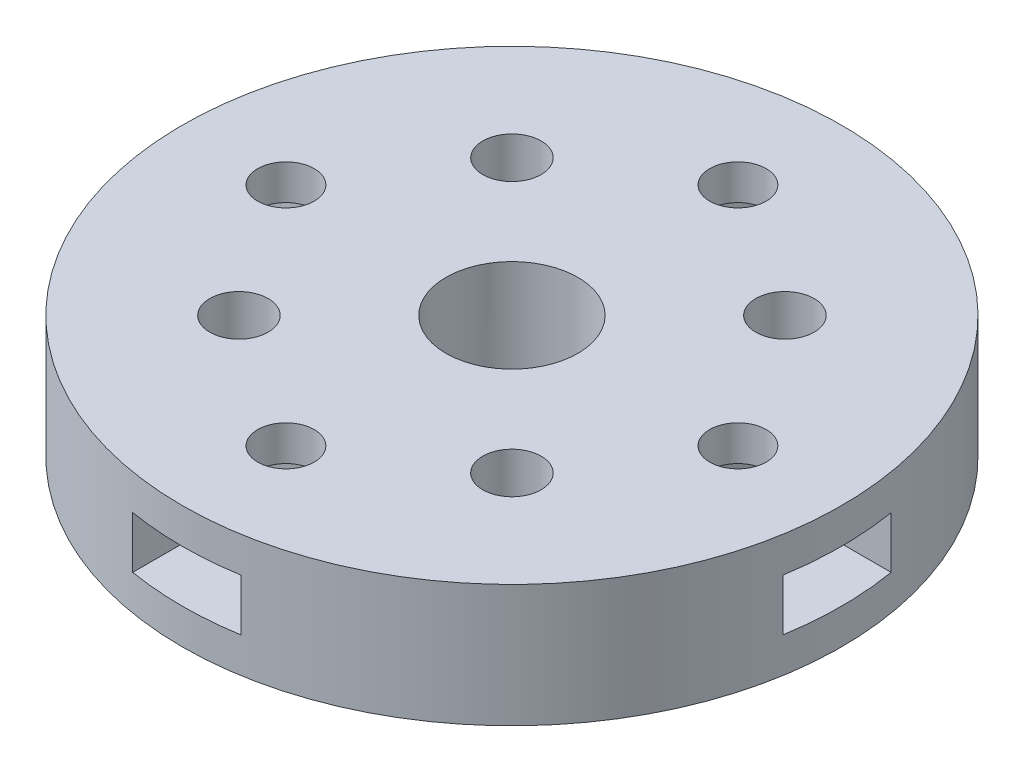
from build123d import *

# Parameters (mm, degrees)
SKETCH1_R                      = 6.05
SKETCH1_R_2                    = 3.05
BOSS_EXTRUDE1_DEPTH            = 10
SKETCH2_R                      = 17.5
BOSS_EXTRUDE2_DEPTH            = 6.5
CUT_EXTRUDE1_REACH             = 28.693
SKETCH3_R                      = 1.5
CUT_EXTRUDE2_DEPTH             = 30.744747435
CUT_EXTRUDE2_DEPTH_BACK        = 30.744747435
SKETCH4_R                      = 1.5
CUT_EXTRUDE3_REACH             = 28.693
SKETCH6_R                      = 3.5
CUT_EXTRUDE3_DIRECTION_2_REACH = 28.693
SKETCH8_W                      = 5.75
SKETCH8_H                      = 2.75
CUT_EXTRUDE4_DEPTH             = 5
CUT_EXTRUDE5_DEPTH             = 2.75
CIRPATTERN1_START              = 11.875
CIRPATTERN1_OUTLINE_R          = 1.5
CIRPATTERN1_DEPTH              = 2.75
SKETCH10_R                     = 6.05
CUT_EXTRUDE6_DEPTH             = 10
SKETCH11_R                     = 1.55
CUT_EXTRUDE7_DEPTH             = 10
SKETCH12_R                     = 2.625
CUT_EXTRUDE8_DEPTH             = 1
CIRPATTERN2_COUNT              = 4


# Read off the part's stored shape, not the designer's step: CirPattern1
with BuildPart() as part:
    # Sketch1 → Boss-Extrude1 (new body)
    with BuildSketch(Plane(origin=(0, 0, 0), x_dir=(1, 0, 0), z_dir=(0, 1, 0))):
        with Locations(Location((0, 0, 0), (0, 0, 270))):
            Circle(SKETCH1_R)
        with Locations(Location((0, 0, 0), (0, 0, 270))):
            Circle(SKETCH1_R_2, mode=Mode.SUBTRACT)
    extrude(amount=BOSS_EXTRUDE1_DEPTH)

    # Sketch2 → Boss-Extrude2 (add)
    with BuildSketch(Plane(origin=(0, 10, 0), x_dir=(1, 0, 0), z_dir=(0, 1, 0))):
        with Locations(Location((0, 0, 0), (0, 0, 90))):
            Circle(SKETCH2_R)
    extrude(amount=BOSS_EXTRUDE2_DEPTH)

    # Sketch3 → Cut-Extrude1 (cut, up to next)
    with BuildSketch(Plane.XZ.offset(-10), mode=Mode.PRIVATE) as cut_extrude1_sk1:
        with Locations(Location((12, 0, 0), (0, 0, 270))):
            Circle(SKETCH3_R)
    cut_extrude1_tool1 = extrude(cut_extrude1_sk1.sketch, amount=-CUT_EXTRUDE1_REACH, mode=Mode.PRIVATE) & part.part
    # Sketch3 → Cut-Extrude1 (cut, up to next)
    with BuildSketch(Plane.XZ.offset(-10), mode=Mode.PRIVATE) as cut_extrude1_sk2:
        with Locations(Location((0, -12, 0), (0, 0, 270))):
            Circle(SKETCH3_R)
    cut_extrude1_tool2 = extrude(cut_extrude1_sk2.sketch, amount=-CUT_EXTRUDE1_REACH, mode=Mode.PRIVATE) & part.part
    # Sketch3 → Cut-Extrude1 (cut, up to next)
    with BuildSketch(Plane.XZ.offset(-10), mode=Mode.PRIVATE) as cut_extrude1_sk3:
        with Locations(Location((-12, 0, 0), (0, 0, 270))):
            Circle(SKETCH3_R)
    cut_extrude1_tool3 = extrude(cut_extrude1_sk3.sketch, amount=-CUT_EXTRUDE1_REACH, mode=Mode.PRIVATE) & part.part
    # Sketch3 → Cut-Extrude1 (cut, up to next)
    with BuildSketch(Plane.XZ.offset(-10), mode=Mode.PRIVATE) as cut_extrude1_sk4:
        with Locations(Location((0, 12, 0), (0, 0, 270))):
            Circle(SKETCH3_R)
    cut_extrude1_tool4 = extrude(cut_extrude1_sk4.sketch, amount=-CUT_EXTRUDE1_REACH, mode=Mode.PRIVATE) & part.part
    add(cut_extrude1_tool1.solids().sort_by_distance((12, 10, 0))[0], mode=Mode.SUBTRACT)
    add(cut_extrude1_tool2.solids().sort_by_distance((0, 10, -12))[0], mode=Mode.SUBTRACT)
    add(cut_extrude1_tool3.solids().sort_by_distance((-12, 10, 0))[0], mode=Mode.SUBTRACT)
    add(cut_extrude1_tool4.solids().sort_by_distance((0, 10, 12))[0], mode=Mode.SUBTRACT)

    # Sketch4 → Cut-Extrude2 (cut, two sides: drawn at the far end of the back side and taken through both)
    with BuildSketch(Plane.XY.offset(-CUT_EXTRUDE2_DEPTH_BACK)):
        with Locations((0, 4.916404418)):
            Circle(SKETCH4_R)
    extrude(amount=CUT_EXTRUDE2_DEPTH + CUT_EXTRUDE2_DEPTH_BACK, mode=Mode.SUBTRACT)

    # Sketch6 → Cut-Extrude3 (cut, up to next)
    with BuildSketch(Plane(origin=(0, 10, 0), x_dir=(-1, 0, 0), z_dir=(0, -1, 0)), mode=Mode.PRIVATE) as cut_extrude3_sk1:
        with Locations(Location((0, 0, 0), (0, 0, 270))):
            Circle(SKETCH6_R)
    cut_extrude3_tool1 = extrude(cut_extrude3_sk1.sketch, amount=-CUT_EXTRUDE3_REACH, mode=Mode.PRIVATE) & part.part
    add(cut_extrude3_tool1.solids().sort_by_distance((0, 10, 0))[0], mode=Mode.SUBTRACT)

    # Sketch6 → Cut-Extrude3 direction 2 (cut, up to next)
    with BuildSketch(Plane(origin=(0, 10, 0), x_dir=(-1, 0, 0), z_dir=(0, -1, 0)), mode=Mode.PRIVATE) as cut_extrude3_direction_2_sk1:
        with Locations(Location((0, 0, 0), (0, 0, 270))):
            Circle(SKETCH6_R)
    cut_extrude3_direction_2_tool1 = extrude(cut_extrude3_direction_2_sk1.sketch, amount=CUT_EXTRUDE3_DIRECTION_2_REACH, mode=Mode.PRIVATE) & part.part
    add(cut_extrude3_direction_2_tool1.solids().sort_by_distance((0, 10, 0))[0], mode=Mode.SUBTRACT)

    # Sketch8 → Cut-Extrude4 (cut)
    with BuildSketch(Plane(origin=(17.5, 0, 0), x_dir=(0, 0, -1), z_dir=(1, 0, 0))):
        with Locations((0, 13.25)):
            Rectangle(SKETCH8_W, SKETCH8_H)
    extrude(amount=-CUT_EXTRUDE4_DEPTH, mode=Mode.SUBTRACT)

    # Sketch9 → Cut-Extrude5 (cut)
    with BuildSketch(Plane.XZ.offset(-14.625)):
        Polygon((15.319764048, 0), (13.659882024, 2.875), (10.340117976, 2.875), (8.680235952, 0), (10.340117976, -2.875), (13.659882024, -2.875), align=None)
    extrude(amount=CUT_EXTRUDE5_DEPTH, mode=Mode.SUBTRACT)

    # CirPattern1 outline → CirPattern1 (cut)
    # profile 1 of 3: a face of its own
    with BuildSketch(Plane(origin=(0, 0, 0), x_dir=(1, 0, 0), z_dir=(0, 1, 0)).offset(CIRPATTERN1_START)):
        with BuildLine():
            Line((-8.680235952, 0), (-10.340117976, 2.875))
            Line((-10.340117976, 2.875), (-17.26222393, 2.875))
            ThreePointArc((-17.26222393, 2.875), (-17.5, 0), (-17.26222393, -2.875))
            Line((-17.26222393, -2.875), (-10.340117976, -2.875))
            Line((-10.340117976, -2.875), (-8.680235952, 0))
        make_face()
        with Locations((-12, 0)):
            Circle(CIRPATTERN1_OUTLINE_R, mode=Mode.SUBTRACT)
    # profile 2 of 3: a face of its own
    with BuildSketch(Plane(origin=(0, 0, 0), x_dir=(1, 0, 0), z_dir=(0, 1, 0)).offset(CIRPATTERN1_START)):
        with BuildLine():
            ThreePointArc((2.875, 17.26222393), (0, 17.5), (-2.875, 17.26222393))
            Line((-2.875, 17.26222393), (-2.875, 10.340117976))
            Line((-2.875, 10.340117976), (0, 8.680235952))
            Line((0, 8.680235952), (2.875, 10.340117976))
            Line((2.875, 10.340117976), (2.875, 17.26222393))
        make_face()
        with Locations((0, 12)):
            Circle(CIRPATTERN1_OUTLINE_R, mode=Mode.SUBTRACT)
    # profile 3 of 3: a face of its own
    with BuildSketch(Plane(origin=(0, 0, 0), x_dir=(1, 0, 0), z_dir=(0, 1, 0)).offset(CIRPATTERN1_START)):
        with BuildLine():
            Line((-2.875, -10.340117976), (-2.875, -17.26222393))
            ThreePointArc((-2.875, -17.26222393), (0, -17.5), (2.875, -17.26222393))
            Line((2.875, -17.26222393), (2.875, -10.340117976))
            Line((2.875, -10.340117976), (0, -8.680235952))
            Line((0, -8.680235952), (-2.875, -10.340117976))
        make_face()
        with Locations((0, -12)):
            Circle(CIRPATTERN1_OUTLINE_R, mode=Mode.SUBTRACT)
    extrude(amount=CIRPATTERN1_DEPTH, mode=Mode.SUBTRACT)

    # Sketch10 → Cut-Extrude6 (cut)
    with BuildSketch(Plane.XZ):
        Circle(SKETCH10_R)
    extrude(amount=-CUT_EXTRUDE6_DEPTH, mode=Mode.SUBTRACT)

    # Sketch11 → Cut-Extrude7 (cut)
    with BuildSketch(Plane(origin=(0, 16.5, 0), x_dir=(1, 0, 0), z_dir=(0, 1, 0))):
        with Locations(Location((-7.247844507, -7.247844507, 0), (0, 0, 270))):
            Circle(SKETCH11_R)
        with Locations(Location((-7.247844507, 7.247844507, 0), (0, 0, 270))):
            Circle(SKETCH11_R)
        with Locations(Location((7.247844507, 7.247844507, 0), (0, 0, 270))):
            Circle(SKETCH11_R)
        with Locations(Location((7.247844507, -7.247844507, 0), (0, 0, 270))):
            Circle(SKETCH11_R)
    extrude(amount=-CUT_EXTRUDE7_DEPTH, mode=Mode.SUBTRACT)

    # Sketch12 → Cut-Extrude8 (cut)
    with BuildSketch(Plane.XZ.offset(-10)):
        with Locations(Location((0, -12, 0), (0, 0, 270))):
            Circle(SKETCH12_R)
    cut_extrude8 = extrude(amount=-CUT_EXTRUDE8_DEPTH, mode=Mode.SUBTRACT)

    # CirPattern2: Cut-Extrude8 ×4 about axis
    cirpattern2_axis = Axis((0, 0, 0), (0, 1, 0))
    for i in range(1, CIRPATTERN2_COUNT):
        add(cut_extrude8.rotate(cirpattern2_axis, i * 360 / CIRPATTERN2_COUNT), mode=Mode.SUBTRACT)


solid = part.part
